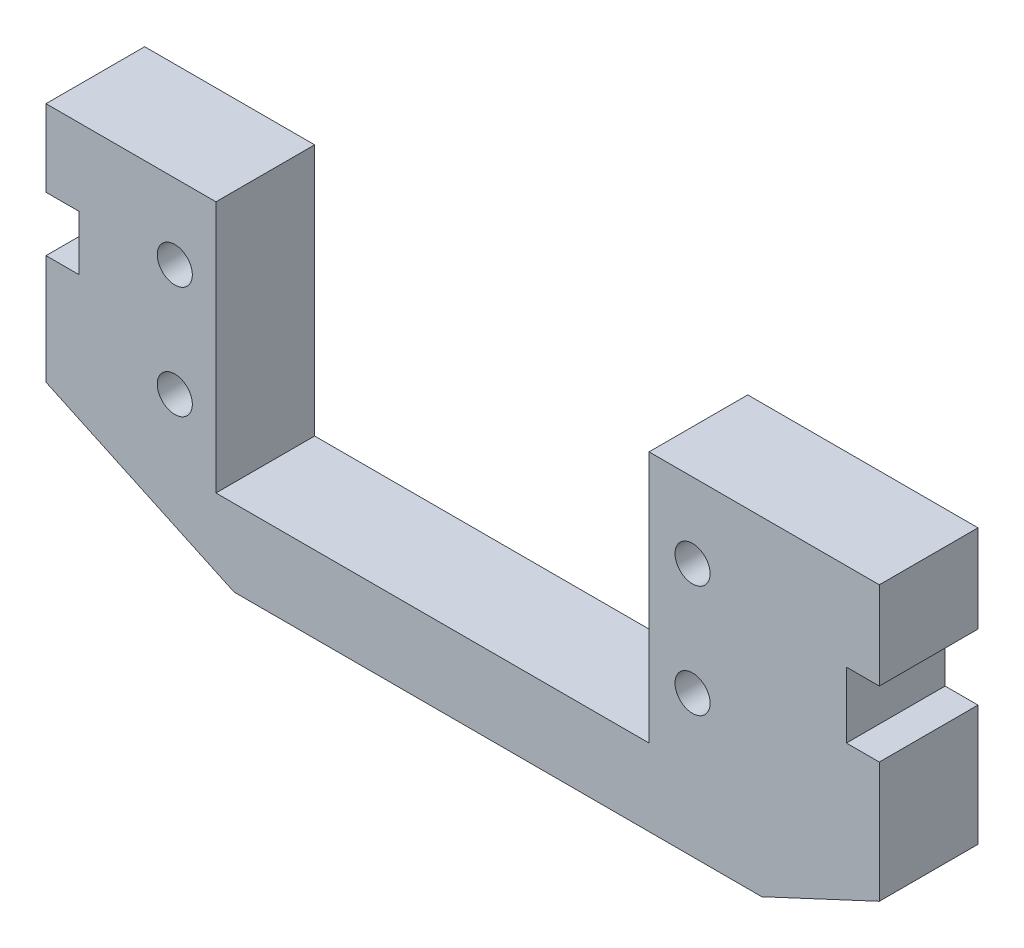
from build123d import *

# Parameters (mm, degrees)
BOSS_EXTRU_1_DEPTH      = 9
ESQUISSE2_R             = 1.6
ENL_V_MAT_EXTRU_1_DEPTH = 83.20097323
CHANFREIN1_SIZE         = 8
CHANFREIN1_SIZE2        = 17.156055364
CHANFREIN2_SIZE         = 5
CHANFREIN2_SIZE2        = 10.722534603
ESQUISSE3_W             = 3
ESQUISSE3_H             = 6
ESQUISSE3_H_2           = 5
ENL_V_MAT_EXTRU_2_DEPTH = 83.20097323


with BuildPart() as part:
    # Esquisse1 → Boss.-Extru.1 (new body)
    with BuildSketch(Plane.XY):
        Polygon((0, 0), (0, -30), (76, -30), (76, 0), (55, 0), (55, -23), (15.5, -23), (15.5, 0), align=None)
    extrude(amount=BOSS_EXTRU_1_DEPTH)

    # Esquisse2 → Enlèv. mat.-Extru.1 (cut, through all)
    with BuildSketch(Plane(origin=(0, 0, 0), x_dir=(-1, 0, 0), z_dir=(0, 0, -1))):
        with Locations((-11.746558558, -17.076326178)):
            Circle(ESQUISSE2_R)
        with Locations((-11.746558558, -6.848778822)):
            Circle(ESQUISSE2_R)
        with Locations((-58.966054895, -17.076326178)):
            Circle(ESQUISSE2_R)
        with Locations((-58.966054895, -6.848778822)):
            Circle(ESQUISSE2_R)
    extrude(amount=-ENL_V_MAT_EXTRU_1_DEPTH, mode=Mode.SUBTRACT)

    # Chanfrein1
    chanfrein1_edges = [part.edges().sort_by_distance(p)[0] for p in [
        (0, -30, 4.5),
    ]]
    chanfrein1_side = [part.faces().sort_by_distance(p)[0] for p in [
        (0, -15, 4.5),
    ]]
    chamfer(chanfrein1_edges, length=CHANFREIN1_SIZE, length2=CHANFREIN1_SIZE2, reference=chanfrein1_side[0])

    # Chanfrein2
    chanfrein2_edges = [part.edges().sort_by_distance(p)[0] for p in [
        (76, -30, 4.5),
    ]]
    chanfrein2_side = [part.faces().sort_by_distance(p)[0] for p in [
        (76, -15, 4.5),
    ]]
    chamfer(chanfrein2_edges, length=CHANFREIN2_SIZE, length2=CHANFREIN2_SIZE2, reference=chanfrein2_side[0])

    # Esquisse3 → Enlèv. mat.-Extru.2 (cut, through all)
    with BuildSketch(Plane.XY.offset(9)):
        with Locations((74.5, -11)):
            Rectangle(ESQUISSE3_W, ESQUISSE3_H)
        with Locations((1.5, -9.5)):
            Rectangle(ESQUISSE3_W, ESQUISSE3_H_2)
    extrude(amount=-ENL_V_MAT_EXTRU_2_DEPTH, mode=Mode.SUBTRACT)


solid = part.part
